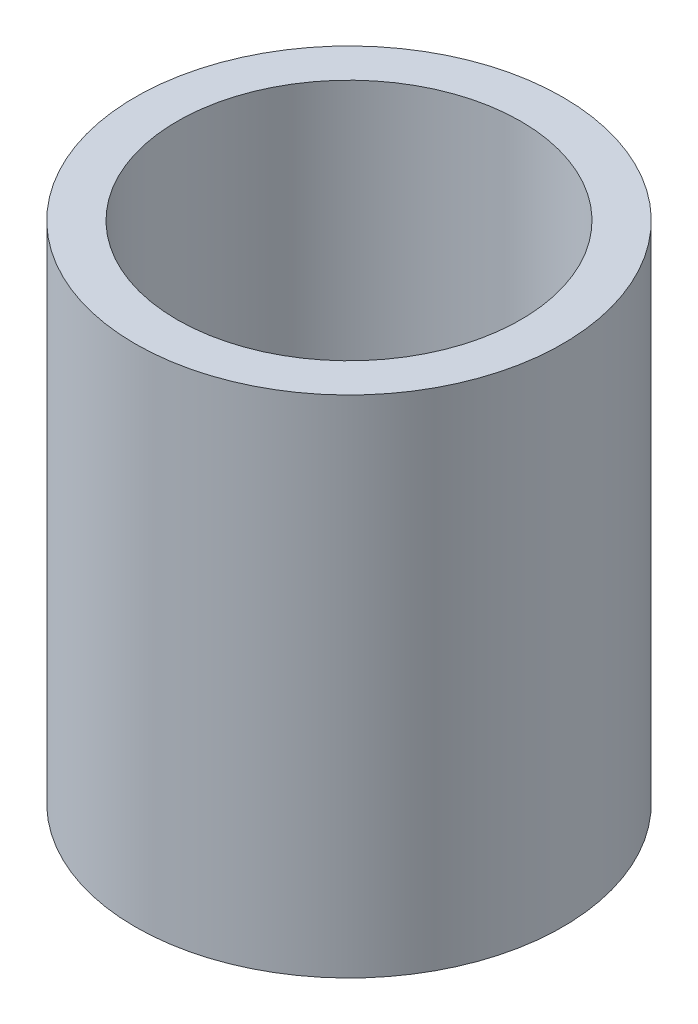
from build123d import *

# Parameters (mm, degrees)
SKETCH1_R           = 6.35
SKETCH1_R_2         = 5.1054
BOSS_EXTRUDE1_DEPTH = 15


with BuildPart() as part:
    # Sketch1 → Boss-Extrude1 (new body)
    with BuildSketch(Plane.XZ.offset(-70.82128008)):
        Circle(SKETCH1_R)
        Circle(SKETCH1_R_2, mode=Mode.SUBTRACT)
    extrude(amount=BOSS_EXTRUDE1_DEPTH)


solid = part.part
